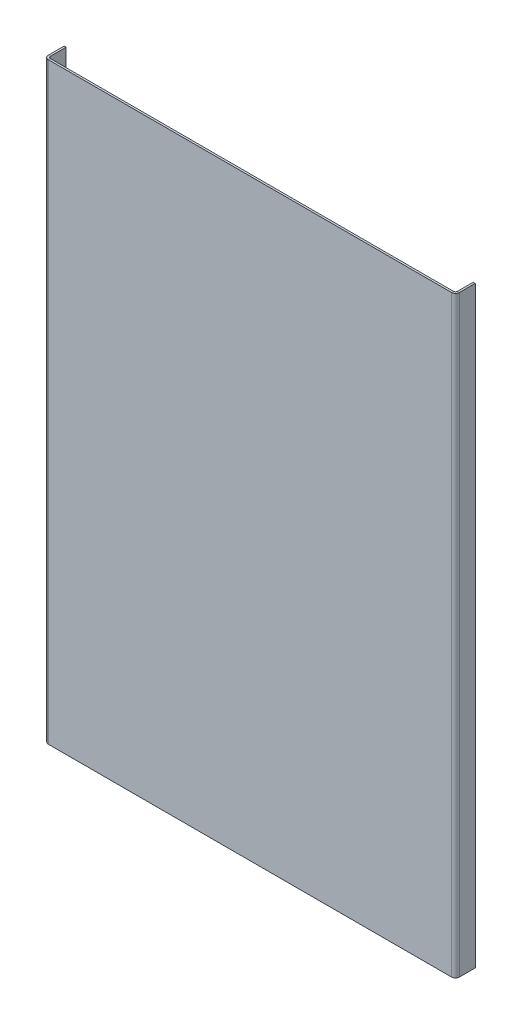
from build123d import *

# Parameters (mm, degrees)
SKETCH1_W          = 204
SKETCH1_H          = 300
BASE_FLANGE1_DEPTH = 1
EDGE_FLANGE1_DEPTH = 300


# Sheet-metal steps are written as plain solids
with BuildPart() as part:
    # Sketch1 → Base-Flange1 (new body)
    with BuildSketch(Plane.XY):
        Rectangle(SKETCH1_W, SKETCH1_H)
    extrude(amount=-BASE_FLANGE1_DEPTH)

    # Edge-Flange1 section (across the edge) → Edge-Flange1 (add)
    with BuildSketch(Plane(origin=(103, 150, -1), x_dir=(-1, 0, 0), z_dir=(0, -1, 0))):
        with BuildLine():
            Line((-1, 1), (-1, 9))
            Line((-1, 9), (0, 9))
            Line((0, 9), (0, 1))
            ThreePointArc((0, 1), (0.292893219, 0.292893219), (1, 0))
            Line((1, 0), (1, -1))
            ThreePointArc((1, -1), (-0.414213562, -0.414213562), (-1, 1))
        make_face()
    edge_flange1 = extrude(amount=EDGE_FLANGE1_DEPTH)

    # Mirror1: Edge-Flange1 across plane
    add(edge_flange1.mirror(Plane(origin=(0, 0, 0), x_dir=(0, 0, 1), z_dir=(1, 0, 0))))


solid = part.part
